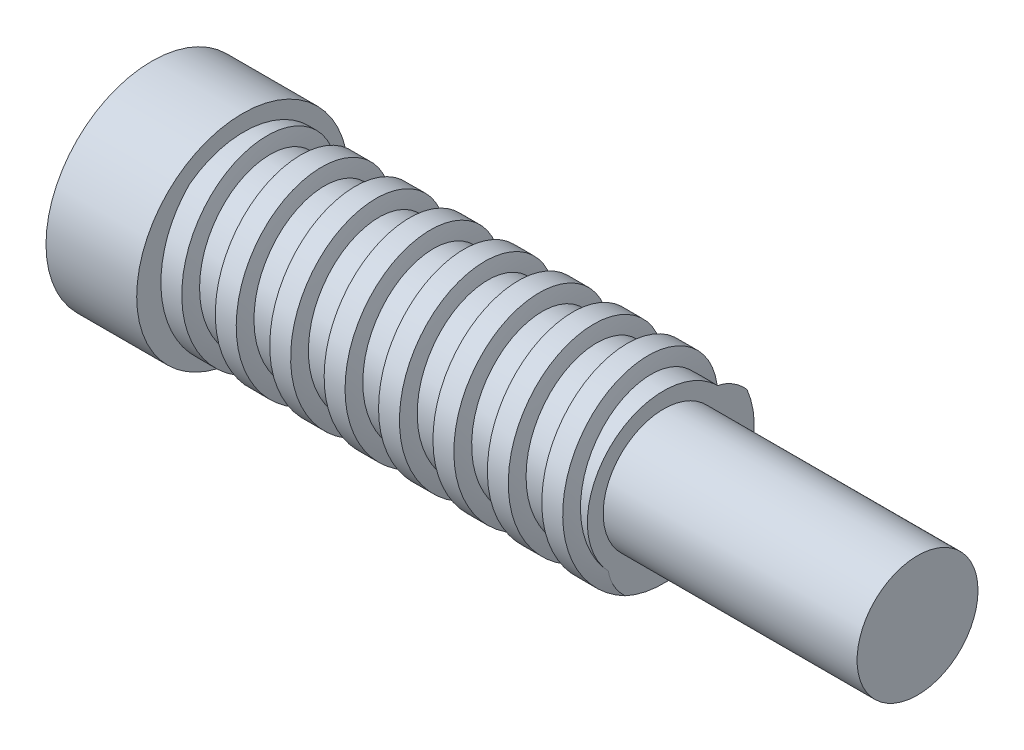
from build123d import *

# Parameters (mm, degrees)
SCHIZZO1_W                    = 18
SCHIZZO1_H                    = 3
TAGLIA_SWEEP2_PITCH           = 1.8
TAGLIO_ESTRUSIONE1_DEPTH      = 22.831031591
TAGLIO_ESTRUSIONE1_DEPTH_BACK = 22.831031591
SCHIZZO4_W                    = 8.198531183
SCHIZZO4_H                    = 9.64484115
SCHIZZO5_R                    = 3.5
ESTRUSIONE_ESTRUSIONE1_DEPTH  = 3
TAGLIO_ESTRUSIONE2_DEPTH      = 5
SCHIZZO7_R                    = 2
ESTRUSIONE_ESTRUSIONE2_DEPTH  = 8.4


with BuildPart() as part:
    # Schizzo1 → Rivoluzione1 (revolve)
    with BuildSketch(Plane.XY, mode=Mode.PRIVATE) as rivoluzione1_sk:
        with Locations((12.047813411, 2.728571429)):
            Rectangle(SCHIZZO1_W, SCHIZZO1_H)
    revolve(rivoluzione1_sk.sketch.rotate(Axis((3.047813411, 1.228571429, 0), (1, 0, 0)), 90), axis=Axis((3.047813411, 1.228571429, 0), (1, 0, 0)))

    # Taglia-Sweep2: arcs per turn and ends read off the stored shape
    # Taglia-Sweep2: the profile of Schizzo2 screwed along a right-hand helix through 16 turns, 10 arcs to a turn; built about Z, then put on its axis
    taglia_sweep2_z = Axis((0, 0, 0), (0, 0, 1))
    taglia_sweep2_corners = [(4.046792557, -7.06e-07, 0.719027419), (4.046792557, -7.06e-07, -1.3430718), (2.517220769, -4.39e-07, -0.75862708), (2.517220769, -4.39e-07, 0.134582698)]
    with BuildLine(mode=Mode.PRIVATE) as taglia_sweep2_profile:
        Line(taglia_sweep2_corners[0], taglia_sweep2_corners[1])
        ThreePointArc((4.046792557, -7.06e-07, -1.3430718), (3.312476576, -5.78e-07, -0.971105509), (2.517220769, -4.39e-07, -0.75862708))
        ThreePointArc((2.517220769, -4.39e-07, -0.75862708), (2.523656167, -4.4e-07, -0.312022191), (2.517220769, -4.39e-07, 0.134582698))
        ThreePointArc((2.517220769, -4.39e-07, 0.134582698), (3.312476576, -5.78e-07, 0.347061127), (4.046792557, -7.06e-07, 0.719027419))
    taglia_sweep2_cap = Face(taglia_sweep2_profile.wire())
    taglia_sweep2_arcs = [((4.046792557, -7.06e-07, -1.3430718), (3.343616319, -5.84e-07, -0.889608542), (2.517220769, -4.39e-07, -0.75862708), (1, 0.9784895593094171, 1)), ((2.517220769, -4.39e-07, -0.75862708), (2.530094238, -4.42e-07, -0.312022191), (2.517220769, -4.39e-07, 0.134582698), (1, 0.9995848130259921, 1)), ((2.517220769, -4.39e-07, 0.134582698), (3.343616319, -5.84e-07, 0.26556416), (4.046792557, -7.06e-07, 0.719027419), (1, 0.9784895593094167, 1))]  # start, shoulder, end, weights
    taglia_sweep2_turn_angles = [0, 18, 36, 54, 72, 90, 108, 126, 144, 162, 180, 198, 216, 234, 252, 270, 288, 306, 324, 342, 360]
    taglia_sweep2_turn_weights = [1, 0.9510565162951535, 1, 0.9510565162951535, 1, 0.9510565162951535, 1, 0.9510565162951535, 1, 0.9510565162951535, 1, 0.9510565162951535, 1, 0.9510565162951535, 1, 0.9510565162951535, 1, 0.9510565162951535, 1, 0.9510565162951535, 1]
    taglia_sweep2_turn_rails = [Edge.make_bspline([Vector(p[0], p[1], 0).rotate(taglia_sweep2_z, taglia_sweep2_turn_angles[k]) / taglia_sweep2_turn_weights[k] + Vector(0, 0, p[2] + TAGLIA_SWEEP2_PITCH * taglia_sweep2_turn_angles[k] / 360) for k in range(21)], [0, 0, 0, 1, 1, 2, 2, 3, 3, 4, 4, 5, 5, 6, 6, 7, 7, 8, 8, 9, 9, 10, 10, 10], 2, taglia_sweep2_turn_weights) for p in taglia_sweep2_corners]
    taglia_sweep2_turn_sides = [*[Face.make_surface_from_curves(taglia_sweep2_turn_rails[p[0]], taglia_sweep2_turn_rails[p[1]]) for p in [(0, 1)]], *[Face.make_bezier_surface([[Vector(p[j][0], p[j][1], 0).rotate(taglia_sweep2_z, taglia_sweep2_turn_angles[2 * i + k]) / taglia_sweep2_turn_weights[2 * i + k] + Vector(0, 0, p[j][2] + TAGLIA_SWEEP2_PITCH * taglia_sweep2_turn_angles[2 * i + k] / 360) for k in range(3)] for j in range(3)], [[p[3][j] * taglia_sweep2_turn_weights[2 * i + k] for k in range(3)] for j in range(3)]) for p in taglia_sweep2_arcs for i in range(10)]]
    taglia_sweep2 = Plane(origin=(24.047813411, 1.228571429, 0), x_dir=(0, 0, 1), z_dir=(-1, 0, 0)) * Solid(Shell([*[p.moved(Location((0, 0, TAGLIA_SWEEP2_PITCH * i))) for i in range(16) for p in taglia_sweep2_turn_sides], taglia_sweep2_cap, taglia_sweep2_cap.rotate(taglia_sweep2_z, 5760).moved(Location((0, 0, TAGLIA_SWEEP2_PITCH * 5760 / 360)))]))
    add(taglia_sweep2, mode=Mode.SUBTRACT)

    # Schizzo4 → Taglio-Estrusione1 (cut, two sides: drawn at the far end of the back side and taken through both)
    with BuildSketch(Plane.XY.offset(-TAGLIO_ESTRUSIONE1_DEPTH_BACK)):
        with Locations((21.029409517, 1.631153608)):
            Rectangle(SCHIZZO4_W, SCHIZZO4_H)
    extrude(amount=TAGLIO_ESTRUSIONE1_DEPTH + TAGLIO_ESTRUSIONE1_DEPTH_BACK, mode=Mode.SUBTRACT)


with BuildPart() as body_2:
    # Schizzo5 → Estrusione-Estrusione1 (new body)
    with BuildSketch(Plane(origin=(0, 0, 0), x_dir=(0, 0, -1), z_dir=(1, 0, 0))):
        with Locations((0, 1.228571429)):
            Circle(SCHIZZO5_R)
    extrude(amount=ESTRUSIONE_ESTRUSIONE1_DEPTH)


with BuildPart() as taglio_estrusione2_tool:
    # Schizzo6 → Taglio-Estrusione2 (new body)
    with BuildSketch(Plane.ZY):
        Polygon((0, 2.728571429), (-1.299038106, 1.978571429), (-1.299038106, 0.478571429), (0, -0.271428571), (1.299038106, 0.478571429), (1.299038106, 1.978571429), align=None)
    extrude(amount=-TAGLIO_ESTRUSIONE2_DEPTH)


with BuildPart() as part_1:
    add(part.part)

    # Taglio-Estrusione2: cut by taglio_estrusione2_tool
    add(taglio_estrusione2_tool.part, mode=Mode.SUBTRACT)

    # Schizzo7 → Estrusione-Estrusione2 (add)
    with BuildSketch(Plane(origin=(16.930143925, 0, 0), x_dir=(0, 0, -1), z_dir=(1, 0, 0))):
        with Locations((0, 1.228571429)):
            Circle(SCHIZZO7_R)
    extrude(amount=ESTRUSIONE_ESTRUSIONE2_DEPTH)


with BuildPart() as body_2_1:
    add(body_2.part)

    # Taglio-Estrusione2: cut by taglio_estrusione2_tool
    add(taglio_estrusione2_tool.part, mode=Mode.SUBTRACT)


solid = Compound([part_1.part, body_2_1.part])
